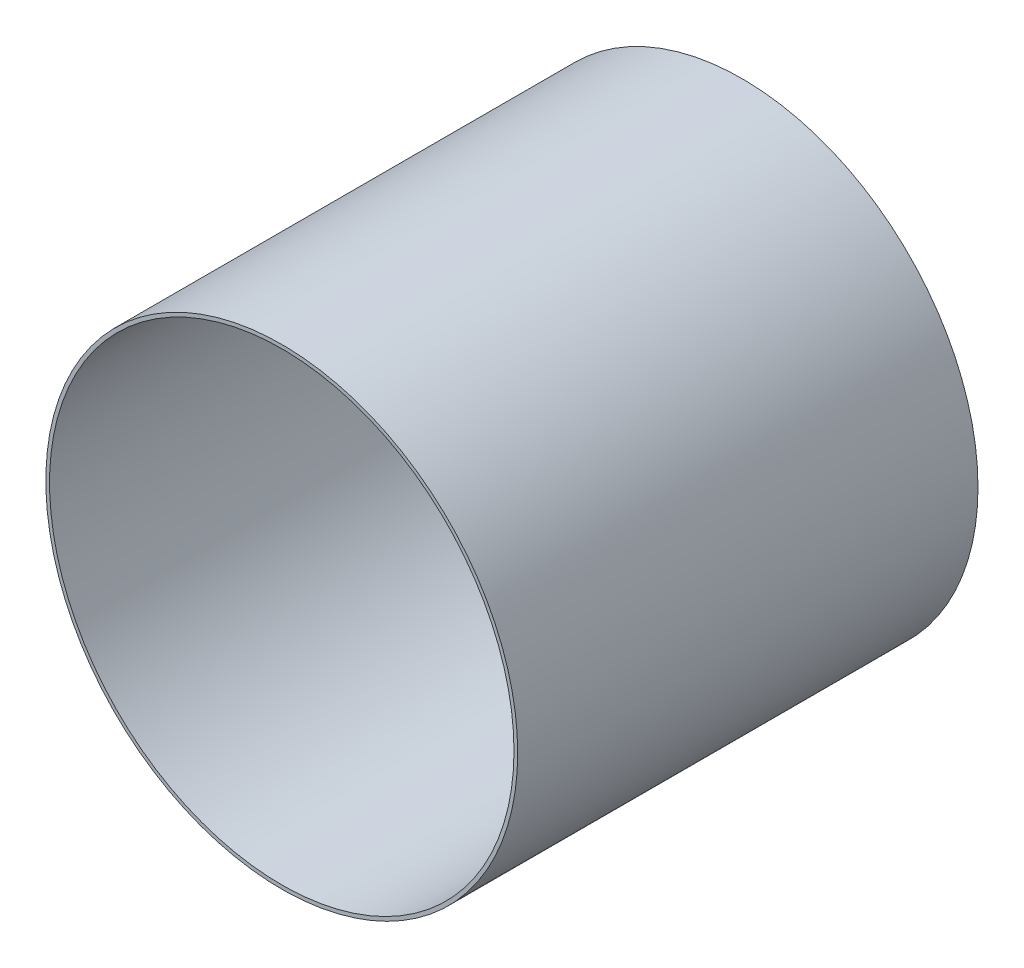
from build123d import *

# Parameters (mm, degrees)
SCHIZZO1_R                   = 500
SCHIZZO1_R_2                 = 492.15
ESTRUSIONE_ESTRUSIONE1_DEPTH = 975.5


with BuildPart() as part:
    # Schizzo1 → Estrusione-Estrusione1 (new body)
    with BuildSketch(Plane.XY):
        Circle(SCHIZZO1_R)
        Circle(SCHIZZO1_R_2, mode=Mode.SUBTRACT)
    extrude(amount=ESTRUSIONE_ESTRUSIONE1_DEPTH)


solid = part.part
